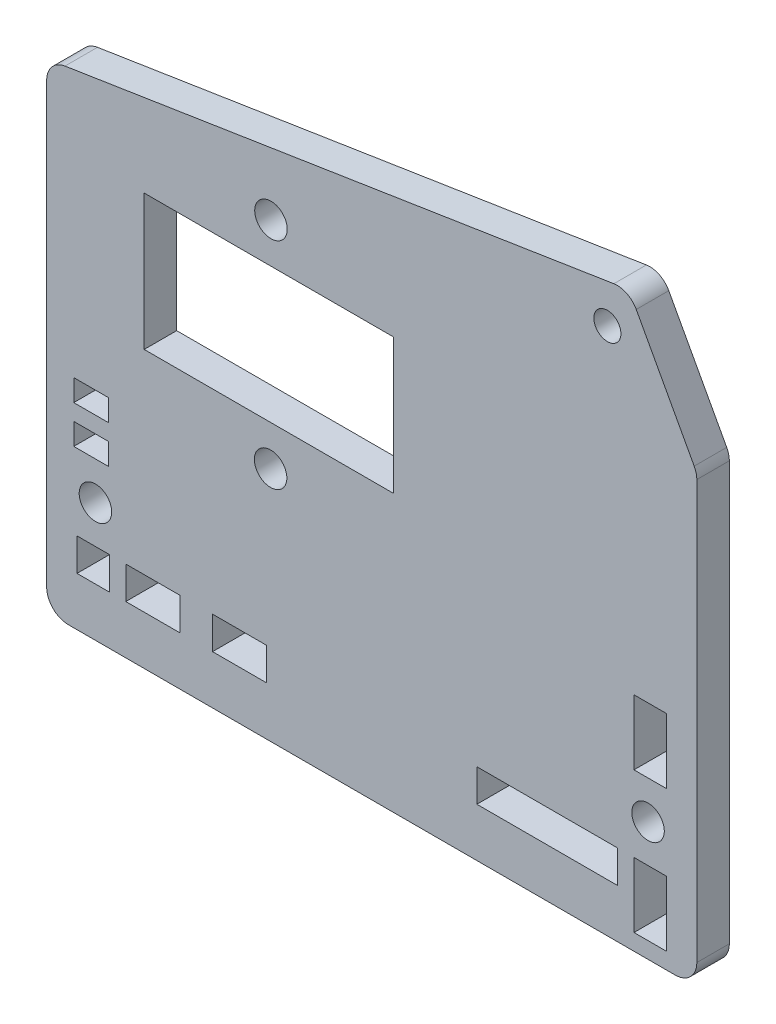
from build123d import *

# Parameters (mm, degrees)
ESQUISSE1_R               = 1.25
ESQUISSE1_R_2             = 1.5
ESQUISSE1_W               = 23
ESQUISSE1_H               = 12.5
ESQUISSE1_W_2             = 13
ESQUISSE1_H_2             = 3
ESQUISSE1_W_3             = 3
ESQUISSE1_H_3             = 6
ESQUISSE1_W_4             = 5
ESQUISSE1_W_5             = 5.008466432
ESQUISSE1_W_6             = 3.2
ESQUISSE1_H_4             = 2
T_LE_DE_BASE_PLI_E1_DEPTH = 3
ESQUISSE2_R               = 1.5
ENL_V_MAT_EXTRU_1_DEPTH   = 10


# Sheet-metal steps are written as plain solids
with BuildPart() as part:
    # Esquisse1 → Tôle de base pliée1 (new body)
    with BuildSketch(Plane.XY):
        with BuildLine():
            Line((0, 42.516223037), (0, 2))
            ThreePointArc((0, 2), (0.585786438, 0.585786438), (2, 0))
            Line((2, 0), (58, 0))
            ThreePointArc((58, 0), (59.414213562, 0.585786438), (60, 2))
            Line((60, 2), (60, 40.598160001))
            ThreePointArc((60, 40.598160001), (59.938461819, 41.090466587), (59.757634225, 41.552477522))
            Line((59.757634225, 41.552477522), (54.409971269, 51.401647463))
            ThreePointArc((54.409971269, 51.401647463), (53.538493891, 52.240295654), (52.342948156, 52.423254667))
            Line((52.342948156, 52.423254667), (1.690611112, 44.492147761))
            ThreePointArc((1.690611112, 44.492147761), (0.480332639, 43.816458059), (0, 42.516223037))
        make_face()
        with Locations((51.745273693, 48.75)):
            Circle(ESQUISSE1_R, mode=Mode.SUBTRACT)
        with Locations((20.7, 41.7)):
            Circle(ESQUISSE1_R_2, mode=Mode.SUBTRACT)
        with Locations((4.5, 11)):
            Circle(ESQUISSE1_R_2, mode=Mode.SUBTRACT)
        with Locations((55.5, 11)):
            Circle(ESQUISSE1_R_2, mode=Mode.SUBTRACT)
        with Locations((20.5, 31.75)):
            Rectangle(ESQUISSE1_W, ESQUISSE1_H, mode=Mode.SUBTRACT)
        with Locations((46.2, 6)):
            Rectangle(ESQUISSE1_W_2, ESQUISSE1_H_2, mode=Mode.SUBTRACT)
        with Locations((55.7, 4.5)):
            Rectangle(ESQUISSE1_W_3, ESQUISSE1_H_3, mode=Mode.SUBTRACT)
        with Locations((55.7, 17.5)):
            Rectangle(ESQUISSE1_W_3, ESQUISSE1_H_3, mode=Mode.SUBTRACT)
        with Locations((17.808466432, 6)):
            Rectangle(ESQUISSE1_W_4, ESQUISSE1_H_2, mode=Mode.SUBTRACT)
        with Locations((9.804233216, 6)):
            Rectangle(ESQUISSE1_W_5, ESQUISSE1_H_2, mode=Mode.SUBTRACT)
        with Locations((4.3, 6)):
            Rectangle(ESQUISSE1_W_3, ESQUISSE1_H_2, mode=Mode.SUBTRACT)
        with Locations((4.1, 15.5)):
            Rectangle(ESQUISSE1_W_6, ESQUISSE1_H_4, mode=Mode.SUBTRACT)
        with Locations((4.1, 19)):
            Rectangle(ESQUISSE1_W_6, ESQUISSE1_H_4, mode=Mode.SUBTRACT)
    extrude(amount=-T_LE_DE_BASE_PLI_E1_DEPTH)

    # Esquisse2 → Enlèv. mat.-Extru.1 (cut)
    with BuildSketch(Plane(origin=(0, 0, -3), x_dir=(-1, 0, 0), z_dir=(0, 0, -1))):
        with Locations((-20.66577155, 21.799816522)):
            Circle(ESQUISSE2_R)
    extrude(amount=-ENL_V_MAT_EXTRU_1_DEPTH, mode=Mode.SUBTRACT)


solid = part.part
